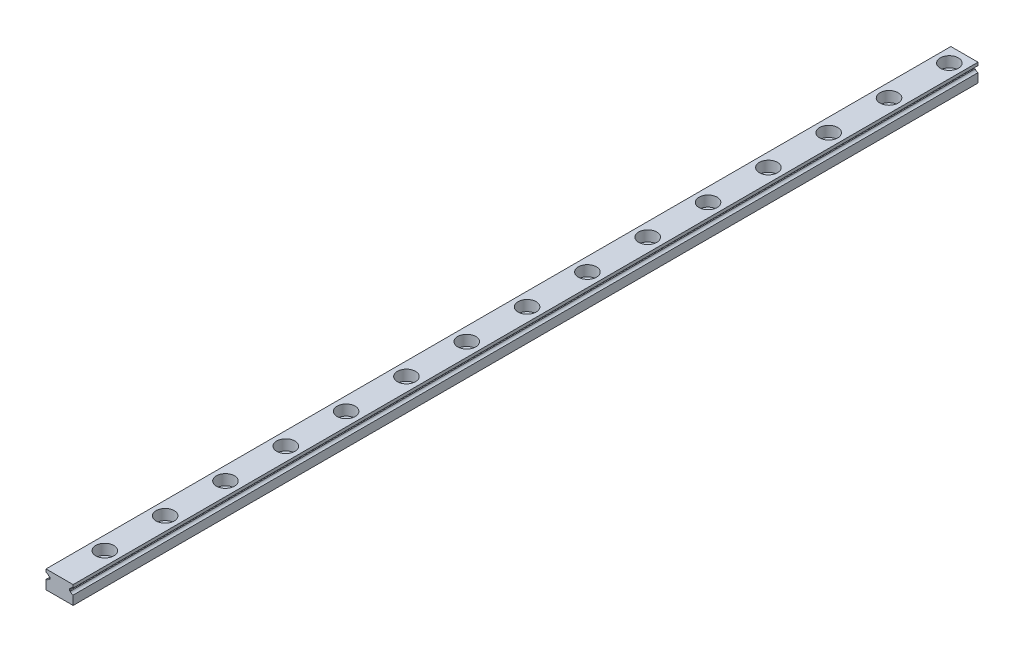
from build123d import *

# Parameters (mm, degrees)
EXTRUDE1_DEPTH  = 300
SKETCH2_R       = 3
EXTRUDE2_DEPTH  = 3.5
SKETCH_R        = 1.75
EXTRUDE3_DEPTH  = 301.093735356
LPATTERN1_COUNT = 15
LPATTERN1_PITCH = 20


with BuildPart() as part:
    # Sketch1 → Extrude1 (new body)
    with BuildSketch(Plane.XY):
        with BuildLine():
            Line((-4.5, -3), (4.5, -3))
            Line((4.5, -3), (4.5, 0))
            ThreePointArc((4.5, 0), (3.93077967, 0.177814974), (3.563991137, 0.648023568))
            Line((3.563991137, 0.648023568), (3.235073025, 0.648023568))
            Line((3.235073025, 0.648023568), (3.235073025, 1.351976432))
            Line((3.235073025, 1.351976432), (3.563991137, 1.351976432))
            ThreePointArc((3.563991137, 1.351976432), (3.93077967, 1.822185026), (4.5, 2))
            Line((4.5, 2), (4.5, 3))
            Line((4.5, 3), (-4.5, 3))
            Line((-4.5, 3), (-4.5, 2))
            ThreePointArc((-4.5, 2), (-3.93077967, 1.822185026), (-3.563991137, 1.351976432))
            Line((-3.563991137, 1.351976432), (-3.235073025, 1.351976432))
            Line((-3.235073025, 1.351976432), (-3.235073025, 0.648023568))
            Line((-3.235073025, 0.648023568), (-3.563991137, 0.648023568))
            ThreePointArc((-3.563991137, 0.648023568), (-3.93077967, 0.177814974), (-4.5, 0))
            Line((-4.5, 0), (-4.5, -3))
        make_face()
    extrude(amount=EXTRUDE1_DEPTH)

    # Sketch2 → Extrude2 (cut)
    with BuildSketch(Plane(origin=(0, 3, 0), x_dir=(1, 0, 0), z_dir=(0, 1, 0))):
        with Locations((0, -5)):
            Circle(SKETCH2_R)
    extrude2 = extrude(amount=-EXTRUDE2_DEPTH, mode=Mode.SUBTRACT)

    # Sketch → Extrude3 (cut, through all)
    with BuildSketch(Plane(origin=(0, 3, 0), x_dir=(1, 0, 0), z_dir=(0, 1, 0))):
        with Locations((0, -5)):
            Circle(SKETCH_R)
    extrude3 = extrude(amount=-EXTRUDE3_DEPTH, mode=Mode.SUBTRACT)

    # LPattern1: Extrude2, Extrude3 ×15
    with Locations(*[(0, 0, i * LPATTERN1_PITCH) for i in range(1, LPATTERN1_COUNT)]):
        add(extrude2, mode=Mode.SUBTRACT)
        add(extrude3, mode=Mode.SUBTRACT)


solid = part.part
